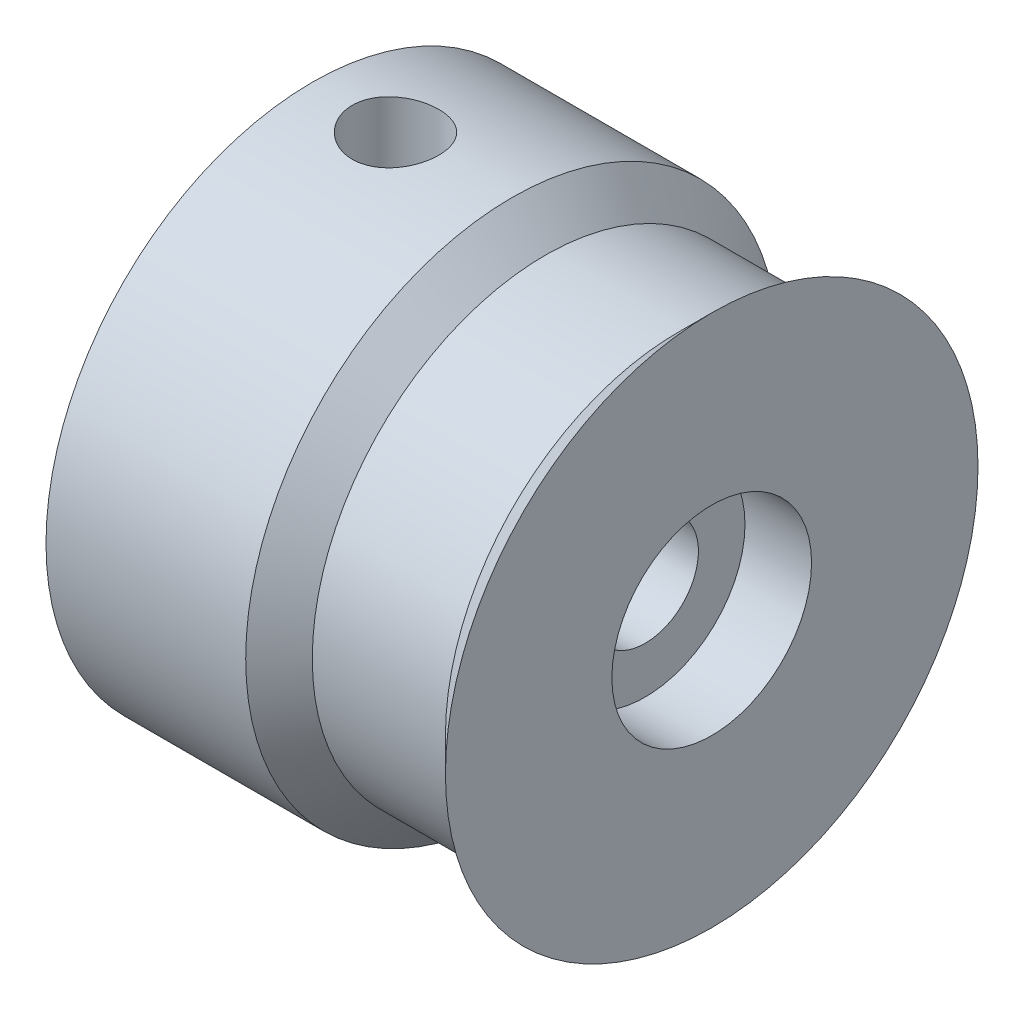
from build123d import *

# Parameters (mm, degrees)
CUT_EXTRUDE1_DEPTH      = 17.492422502
CUT_EXTRUDE1_DEPTH_BACK = 17.492422502
SKETCH2_R               = 1.3
CHAMFER1_SIZE           = 1


with BuildPart() as part:
    # Sketch1 → Revolve1 (revolve)
    with BuildSketch(Plane.XY, mode=Mode.PRIVATE) as revolve1_sk:
        Polygon((0, 4.5), (0, 8), (7, 8), (7, 7), (11, 7), (11, 8), (12, 8), (12, 3), (10, 3), (10, 1.6), (5, 1.6), (5, 4.5), align=None)
    revolve(revolve1_sk.sketch.rotate(Axis((0, 0, 0), (1, 0, 0)), 90), axis=Axis((0, 0, 0), (1, 0, 0)))

    # Sketch2 → Cut-Extrude1 (cut, two sides: drawn at the far end of the back side and taken through both)
    with BuildSketch(Plane(origin=(0, 0, 0), x_dir=(1, 0, 0), z_dir=(0, 1, 0)).offset(-CUT_EXTRUDE1_DEPTH_BACK)):
        with Locations(Location((2.5, 0, 0), (0, 0, 270))):
            Circle(SKETCH2_R)
    extrude(amount=CUT_EXTRUDE1_DEPTH + CUT_EXTRUDE1_DEPTH_BACK, mode=Mode.SUBTRACT)

    # Chamfer1
    chamfer1_edges = [part.edges().sort_by_distance(p)[0] for p in [
        (11, 0, -8),
        (7, 0, -8),
    ]]
    chamfer(chamfer1_edges, length=CHAMFER1_SIZE - 0.0001)  # a hair under: the kernel refuses the full size


solid = part.part
